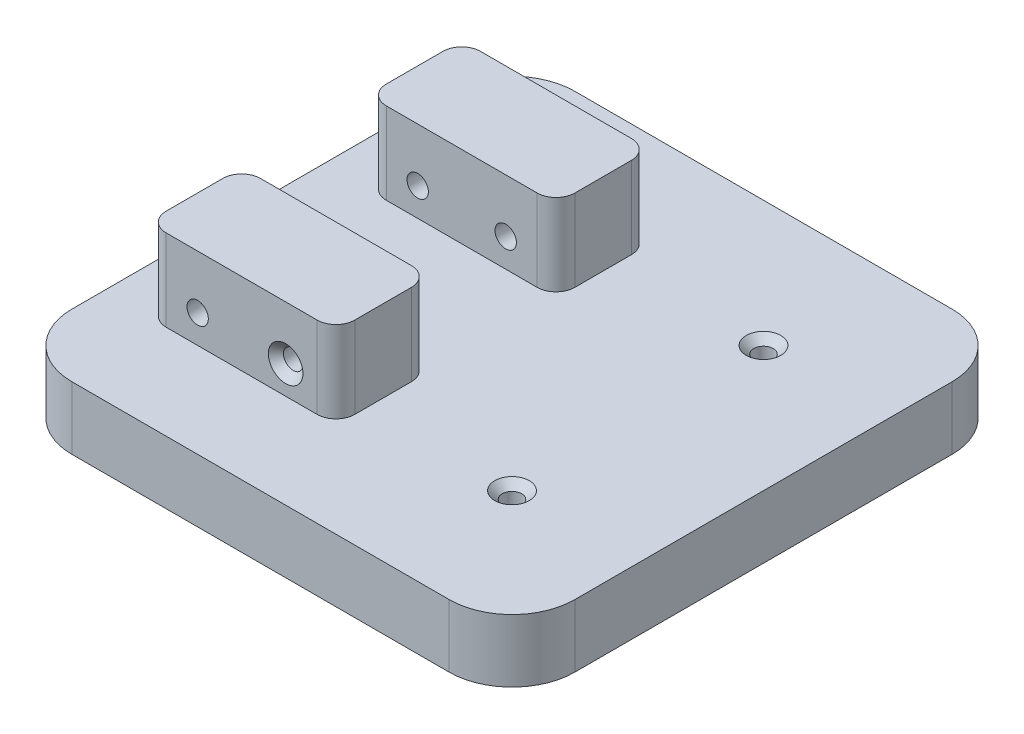
from build123d import *

# Parameters (mm, degrees)
SCHIZZO1_W                               = 80
SCHIZZO1_H                               = 80
ESTRUSIONE_ESTRUSIONE1_DEPTH             = 10
RACCORDO1_R                              = 10
FORO_SVASATO_PER_VITE_M2_5_1_D           = 3.1
FORO_SVASATO_PER_VITE_M2_5_1_CSINK_D     = 5.5
FORO_SVASATO_PER_VITE_M2_5_1_CSINK_ANGLE = 90
SCHIZZO4_W                               = 30
SCHIZZO4_H                               = 15
ESTRUSIONE_ESTRUSIONE2_DEPTH             = 13
FORO_SVASATO_PER_VITE_M2_5_2_D           = 3.1
FORO_SVASATO_PER_VITE_M2_5_2_DEPTH       = 15
FORO_SVASATO_PER_VITE_M2_5_2_CSINK_D     = 5.5
FORO_SVASATO_PER_VITE_M2_5_2_CSINK_ANGLE = 90
FORO_SVASATO_PER_VITE_M2_5_2_TIP         = 0.931333959
RACCORDO2_R                              = 3
SCHIZZO5_R                               = 1.7
TAGLIO_ESTRUSIONE4_DEPTH                 = 15
TAGLIO_ESTRUSIONE5_START                 = -15
SCHIZZO6_R                               = 1.7
TAGLIO_ESTRUSIONE5_DEPTH                 = 15


with BuildPart() as part:
    # Schizzo1 → Estrusione-Estrusione1 (new body)
    with BuildSketch(Plane(origin=(0, 0, 0), x_dir=(1, 0, 0), z_dir=(0, 1, 0))):
        with Locations((-7.6, -4.4)):
            Rectangle(SCHIZZO1_W, SCHIZZO1_H)
    extrude(amount=ESTRUSIONE_ESTRUSIONE1_DEPTH)

    # Raccordo1
    raccordo1_edges = [part.edges().sort_by_distance(p)[0] for p in [
        (-47.6, 5, -35.6),
        (32.4, 5, -35.6),
        (-47.6, 5, 44.4),
        (32.4, 5, 44.4),
    ]]
    fillet(raccordo1_edges, radius=RACCORDO1_R)

    # Foro svasato per Vite M2.5-1 (through all)
    with Locations(Plane(origin=(12.4, 10, -15.6), x_dir=(0, 0, 1), z_dir=(0, 1, 0))):
        with Locations((0, 0), (40, 0)):
            CounterSinkHole(FORO_SVASATO_PER_VITE_M2_5_1_D / 2, FORO_SVASATO_PER_VITE_M2_5_1_CSINK_D / 2, counter_sink_angle=FORO_SVASATO_PER_VITE_M2_5_1_CSINK_ANGLE)

    # Schizzo4 → Estrusione-Estrusione2 (add)
    with BuildSketch(Plane(origin=(0, 10, 0), x_dir=(1, 0, 0), z_dir=(0, 1, 0))):
        with Locations((-25.6, 13.1)):
            Rectangle(SCHIZZO4_W, SCHIZZO4_H)
        with Locations((-25.6, -21.9)):
            Rectangle(SCHIZZO4_W, SCHIZZO4_H)
    extrude(amount=ESTRUSIONE_ESTRUSIONE2_DEPTH)

    # Foro svasato per Vite M2.5-2
    with Locations(Plane(origin=(-18.6, 14.5, 29.4), x_dir=(1, 0, 0), z_dir=(0, 0, 1))):
        with Locations((0, 0)):
            CounterSinkHole(FORO_SVASATO_PER_VITE_M2_5_2_D / 2, FORO_SVASATO_PER_VITE_M2_5_2_CSINK_D / 2, depth=FORO_SVASATO_PER_VITE_M2_5_2_DEPTH, counter_sink_angle=FORO_SVASATO_PER_VITE_M2_5_2_CSINK_ANGLE)
            with Locations((0, 0, -(FORO_SVASATO_PER_VITE_M2_5_2_DEPTH + FORO_SVASATO_PER_VITE_M2_5_2_TIP / 2))):  # 118° drill point
                Cone(0, FORO_SVASATO_PER_VITE_M2_5_2_D / 2, FORO_SVASATO_PER_VITE_M2_5_2_TIP, mode=Mode.SUBTRACT)

    # Raccordo2
    raccordo2_edges = [part.edges().sort_by_distance(p)[0] for p in [
        (-10.6, 16.5, -20.6),
        (-10.6, 16.5, -5.6),
        (-40.6, 16.5, -20.6),
        (-40.6, 16.5, -5.6),
        (-10.6, 16.5, 29.4),
        (-10.6, 16.5, 14.4),
        (-40.6, 16.5, 14.4),
        (-40.6, 16.5, 29.4),
    ]]
    fillet(raccordo2_edges, radius=RACCORDO2_R)

    # Schizzo5 → Taglio-Estrusione4 (cut)
    with BuildSketch(Plane(origin=(0, 0, -20.6), x_dir=(-1, 0, 0), z_dir=(0, 0, -1))):
        with Locations((18.6, 14.5)):
            Circle(SCHIZZO5_R)
        with Locations((32.6, 14.5)):
            Circle(SCHIZZO5_R)
    extrude(amount=-TAGLIO_ESTRUSIONE4_DEPTH, mode=Mode.SUBTRACT)

    # Schizzo6 → Taglio-Estrusione5 (cut)
    with BuildSketch(Plane.XY.offset(29.4).offset(TAGLIO_ESTRUSIONE5_START)):
        with Locations((-32.6, 14.5)):
            Circle(SCHIZZO6_R)
    extrude(amount=TAGLIO_ESTRUSIONE5_DEPTH, mode=Mode.SUBTRACT)


solid = part.part
